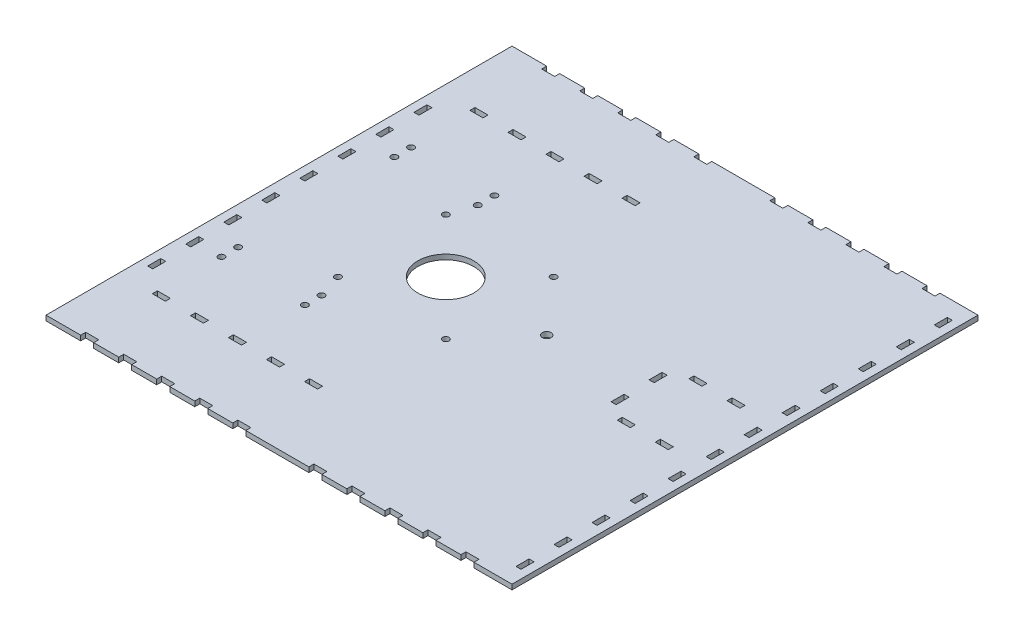
from build123d import *

# Parameters (mm, degrees)
SKETCH1_W                = 279.4
SKETCH1_H                = 279.4
BOSS_EXTRUDE1_DEPTH      = 3
SKETCH3_W                = 3
SKETCH3_H                = 7.8
CUT_EXTRUDE2_DEPTH       = 198.588410591
LPATTERN1_COUNT          = 12
LPATTERN1_PITCH          = 22.8
SKETCH5_W                = 7.8
SKETCH5_H                = 3
CUT_EXTRUDE3_DEPTH       = 198.588410591
LPATTERN2_COUNT          = 11
LPATTERN2_PITCH          = 22.8
MIRROR2_COPY_1_SKETCH_W  = 7.8
MIRROR2_COPY_1_SKETCH_H  = 3
MIRROR2_COPY_1_DEPTH     = 198.588410591
MIRROR2_COPY_2_SKETCH_W  = 7.8
MIRROR2_COPY_2_SKETCH_H  = 3
MIRROR2_COPY_2_DEPTH     = 198.588410591
MIRROR2_COPY_3_SKETCH_W  = 7.8
MIRROR2_COPY_3_SKETCH_H  = 3
MIRROR2_COPY_3_DEPTH     = 198.588410591
MIRROR2_COPY_4_SKETCH_W  = 7.8
MIRROR2_COPY_4_SKETCH_H  = 3
MIRROR2_COPY_4_DEPTH     = 198.588410591
MIRROR2_COPY_5_SKETCH_W  = 7.8
MIRROR2_COPY_5_SKETCH_H  = 3
MIRROR2_COPY_5_DEPTH     = 198.588410591
MIRROR2_COPY_6_SKETCH_W  = 7.8
MIRROR2_COPY_6_SKETCH_H  = 3
MIRROR2_COPY_6_DEPTH     = 198.588410591
MIRROR2_COPY_7_SKETCH_W  = 7.8
MIRROR2_COPY_7_SKETCH_H  = 3
MIRROR2_COPY_7_DEPTH     = 198.588410591
MIRROR2_COPY_8_SKETCH_W  = 7.8
MIRROR2_COPY_8_SKETCH_H  = 3
MIRROR2_COPY_8_DEPTH     = 198.588410591
MIRROR2_COPY_9_SKETCH_W  = 7.8
MIRROR2_COPY_9_SKETCH_H  = 3
MIRROR2_COPY_9_DEPTH     = 198.588410591
MIRROR2_COPY_10_SKETCH_W = 7.8
MIRROR2_COPY_10_SKETCH_H = 3
MIRROR2_COPY_10_DEPTH    = 198.588410591
SKETCH6_W                = 3
SKETCH6_H                = 7.8
CUT_EXTRUDE4_DEPTH       = 198.588410591
LPATTERN3_COUNT          = 8
LPATTERN3_PITCH          = 22.8
SKETCH7_R                = 16.75
CUT_EXTRUDE5_DEPTH       = 198.588410591
F_6_CLEARANCE_HOLE1_D    = 3.7973
F_6_CLEARANCE_HOLE2_D    = 3.7973
SKETCH14_R               = 2.65
CUT_EXTRUDE6_DEPTH       = 198.588410591
SKETCH16_W               = 7.8
SKETCH16_H               = 3
CUT_EXTRUDE8_DEPTH       = 198.588410591
LPATTERN5_COUNT          = 5
LPATTERN5_PITCH          = 22.8
MIRROR4_COPY_1_SKETCH_W  = 7.8
MIRROR4_COPY_1_SKETCH_H  = 3
MIRROR4_COPY_1_DEPTH     = 198.588410591
MIRROR4_COPY_2_SKETCH_W  = 7.8
MIRROR4_COPY_2_SKETCH_H  = 3
MIRROR4_COPY_2_DEPTH     = 198.588410591
MIRROR4_COPY_3_SKETCH_W  = 7.8
MIRROR4_COPY_3_SKETCH_H  = 3
MIRROR4_COPY_3_DEPTH     = 198.588410591
MIRROR4_COPY_4_SKETCH_W  = 7.8
MIRROR4_COPY_4_SKETCH_H  = 3
MIRROR4_COPY_4_DEPTH     = 198.588410591
MIRROR4_COPY_5_SKETCH_W  = 7.8
MIRROR4_COPY_5_SKETCH_H  = 3
MIRROR4_COPY_5_DEPTH     = 198.588410591
SKETCH17_W               = 7.8
SKETCH17_H               = 3
CUT_EXTRUDE9_DEPTH       = 198.588410591
LPATTERN6_COUNT          = 2
LPATTERN6_PITCH          = 22.8
SKETCH18_W               = 3
SKETCH18_H               = 7.8
CUT_EXTRUDE10_DEPTH      = 198.588410591
MIRROR5_COPY_1_SKETCH_W  = 7.8
MIRROR5_COPY_1_SKETCH_H  = 3
MIRROR5_COPY_1_DEPTH     = 198.588410591


with BuildPart() as part:
    # Sketch1 → Boss-Extrude1 (new body)
    with BuildSketch(Plane(origin=(0, 0, 0), x_dir=(1, 0, 0), z_dir=(0, 1, 0))):
        Rectangle(SKETCH1_W, SKETCH1_H)
    extrude(amount=BOSS_EXTRUDE1_DEPTH)

    # Sketch3 → Cut-Extrude2 (cut, through all)
    with BuildSketch(Plane(origin=(0, 0, 0), x_dir=(-1, 0, 0), z_dir=(0, -1, 0))):
        with Locations((-133.2, 125.4)):
            Rectangle(SKETCH3_W, SKETCH3_H)
    cut_extrude2 = extrude(amount=-CUT_EXTRUDE2_DEPTH, mode=Mode.SUBTRACT)

    # LPattern1: Cut-Extrude2 ×12
    with Locations(*[(0, 0, i * LPATTERN1_PITCH) for i in range(1, LPATTERN1_COUNT)]):
        add(cut_extrude2, mode=Mode.SUBTRACT)

    # Sketch5 → Cut-Extrude3 (cut, through all)
    with BuildSketch(Plane.XZ):
        with Locations((113, -138.2)):
            Rectangle(SKETCH5_W, SKETCH5_H)
    cut_extrude3 = extrude(amount=-CUT_EXTRUDE3_DEPTH, mode=Mode.SUBTRACT)

    # LPattern2: Cut-Extrude3 ×11, 1 skipped
    with Locations(*[(-i * LPATTERN2_PITCH, 0, 0) for i in range(1, LPATTERN2_COUNT) if i not in (5,)]):
        add(cut_extrude3, mode=Mode.SUBTRACT)

    # Mirror2 copy 1 sketch → Mirror2 copy 1 (cut, through all)
    with BuildSketch(Plane(origin=(-22.8, 0, 0), x_dir=(1, 0, 0), z_dir=(0, -1, 0))):
        with Locations((113, 138.2)):
            Rectangle(MIRROR2_COPY_1_SKETCH_W, MIRROR2_COPY_1_SKETCH_H)
    extrude(amount=-MIRROR2_COPY_1_DEPTH, mode=Mode.SUBTRACT)

    # Mirror2 copy 2 sketch → Mirror2 copy 2 (cut, through all)
    with BuildSketch(Plane(origin=(-45.6, 0, 0), x_dir=(1, 0, 0), z_dir=(0, -1, 0))):
        with Locations((113, 138.2)):
            Rectangle(MIRROR2_COPY_2_SKETCH_W, MIRROR2_COPY_2_SKETCH_H)
    extrude(amount=-MIRROR2_COPY_2_DEPTH, mode=Mode.SUBTRACT)

    # Mirror2 copy 3 sketch → Mirror2 copy 3 (cut, through all)
    with BuildSketch(Plane(origin=(-68.4, 0, 0), x_dir=(1, 0, 0), z_dir=(0, -1, 0))):
        with Locations((113, 138.2)):
            Rectangle(MIRROR2_COPY_3_SKETCH_W, MIRROR2_COPY_3_SKETCH_H)
    extrude(amount=-MIRROR2_COPY_3_DEPTH, mode=Mode.SUBTRACT)

    # Mirror2 copy 4 sketch → Mirror2 copy 4 (cut, through all)
    with BuildSketch(Plane(origin=(-91.2, 0, 0), x_dir=(1, 0, 0), z_dir=(0, -1, 0))):
        with Locations((113, 138.2)):
            Rectangle(MIRROR2_COPY_4_SKETCH_W, MIRROR2_COPY_4_SKETCH_H)
    extrude(amount=-MIRROR2_COPY_4_DEPTH, mode=Mode.SUBTRACT)

    # Mirror2 copy 5 sketch → Mirror2 copy 5 (cut, through all)
    with BuildSketch(Plane(origin=(-136.8, 0, 0), x_dir=(1, 0, 0), z_dir=(0, -1, 0))):
        with Locations((113, 138.2)):
            Rectangle(MIRROR2_COPY_5_SKETCH_W, MIRROR2_COPY_5_SKETCH_H)
    extrude(amount=-MIRROR2_COPY_5_DEPTH, mode=Mode.SUBTRACT)

    # Mirror2 copy 6 sketch → Mirror2 copy 6 (cut, through all)
    with BuildSketch(Plane(origin=(-159.6, 0, 0), x_dir=(1, 0, 0), z_dir=(0, -1, 0))):
        with Locations((113, 138.2)):
            Rectangle(MIRROR2_COPY_6_SKETCH_W, MIRROR2_COPY_6_SKETCH_H)
    extrude(amount=-MIRROR2_COPY_6_DEPTH, mode=Mode.SUBTRACT)

    # Mirror2 copy 7 sketch → Mirror2 copy 7 (cut, through all)
    with BuildSketch(Plane(origin=(-182.4, 0, 0), x_dir=(1, 0, 0), z_dir=(0, -1, 0))):
        with Locations((113, 138.2)):
            Rectangle(MIRROR2_COPY_7_SKETCH_W, MIRROR2_COPY_7_SKETCH_H)
    extrude(amount=-MIRROR2_COPY_7_DEPTH, mode=Mode.SUBTRACT)

    # Mirror2 copy 8 sketch → Mirror2 copy 8 (cut, through all)
    with BuildSketch(Plane(origin=(-205.2, 0, 0), x_dir=(1, 0, 0), z_dir=(0, -1, 0))):
        with Locations((113, 138.2)):
            Rectangle(MIRROR2_COPY_8_SKETCH_W, MIRROR2_COPY_8_SKETCH_H)
    extrude(amount=-MIRROR2_COPY_8_DEPTH, mode=Mode.SUBTRACT)

    # Mirror2 copy 9 sketch → Mirror2 copy 9 (cut, through all)
    with BuildSketch(Plane(origin=(-228, 0, 0), x_dir=(1, 0, 0), z_dir=(0, -1, 0))):
        with Locations((113, 138.2)):
            Rectangle(MIRROR2_COPY_9_SKETCH_W, MIRROR2_COPY_9_SKETCH_H)
    extrude(amount=-MIRROR2_COPY_9_DEPTH, mode=Mode.SUBTRACT)

    # Mirror2 copy 10 sketch → Mirror2 copy 10 (cut, through all)
    with BuildSketch(Plane.XZ):
        with Locations((113, 138.2)):
            Rectangle(MIRROR2_COPY_10_SKETCH_W, MIRROR2_COPY_10_SKETCH_H)
    extrude(amount=-MIRROR2_COPY_10_DEPTH, mode=Mode.SUBTRACT)

    # Sketch6 → Cut-Extrude4 (cut, through all)
    with BuildSketch(Plane.XZ):
        with Locations((-133.2, -79.8)):
            Rectangle(SKETCH6_W, SKETCH6_H)
    cut_extrude4 = extrude(amount=-CUT_EXTRUDE4_DEPTH, mode=Mode.SUBTRACT)

    # LPattern3: Cut-Extrude4 ×8
    with Locations(*[(0, 0, i * LPATTERN3_PITCH) for i in range(1, LPATTERN3_COUNT)]):
        add(cut_extrude4, mode=Mode.SUBTRACT)

    # Sketch7 → Cut-Extrude5 (cut, through all)
    with BuildSketch(Plane(origin=(0, 0, 0), x_dir=(-1, 0, 0), z_dir=(0, -1, 0))):
        with Locations((39.7, 0)):
            Circle(SKETCH7_R)
    extrude(amount=-CUT_EXTRUDE5_DEPTH, mode=Mode.SUBTRACT)

    # #6 Clearance Hole1 (through all)
    with Locations(Plane(origin=(0, 3, 0), x_dir=(1, 0, 0), z_dir=(0, 1, 0))):
        with Locations((-72.025, -32.325), (-72.025, 32.325), (-7.375, 32.325), (-7.375, -32.325)):
            Hole(F_6_CLEARANCE_HOLE1_D / 2)

    # #6 Clearance Hole2 (through all)
    with Locations(Plane(origin=(0, 3, 0), x_dir=(1, 0, 0), z_dir=(0, 1, 0))):
        with Locations((-117.36, 56.83), (-67.36, 56.83), (-117.36, -56.83), (-67.36, -56.83), (-67.36, -46.83), (-117.36, -46.83), (-67.36, 46.83), (-117.36, 46.83)):
            Hole(F_6_CLEARANCE_HOLE2_D / 2)

    # Sketch14 → Cut-Extrude6 (cut, through all)
    with BuildSketch(Plane(origin=(0, 0, 0), x_dir=(-1, 0, 0), z_dir=(0, -1, 0))):
        with Locations((-20.8, 0)):
            Circle(SKETCH14_R)
    extrude(amount=-CUT_EXTRUDE6_DEPTH, mode=Mode.SUBTRACT)

    # Sketch16 → Cut-Extrude8 (cut, through all)
    with BuildSketch(Plane.XZ):
        with Locations((-115, 95.2)):
            Rectangle(SKETCH16_W, SKETCH16_H)
    cut_extrude8 = extrude(amount=-CUT_EXTRUDE8_DEPTH, mode=Mode.SUBTRACT)

    # LPattern5: Cut-Extrude8 ×5
    with Locations(*[(i * LPATTERN5_PITCH, 0, 0) for i in range(1, LPATTERN5_COUNT)]):
        add(cut_extrude8, mode=Mode.SUBTRACT)

    # Mirror4 copy 1 sketch → Mirror4 copy 1 (cut, through all)
    with BuildSketch(Plane(origin=(22.8, 0, 0), x_dir=(1, 0, 0), z_dir=(0, -1, 0))):
        with Locations((-115, -95.2)):
            Rectangle(MIRROR4_COPY_1_SKETCH_W, MIRROR4_COPY_1_SKETCH_H)
    extrude(amount=-MIRROR4_COPY_1_DEPTH, mode=Mode.SUBTRACT)

    # Mirror4 copy 2 sketch → Mirror4 copy 2 (cut, through all)
    with BuildSketch(Plane(origin=(45.6, 0, 0), x_dir=(1, 0, 0), z_dir=(0, -1, 0))):
        with Locations((-115, -95.2)):
            Rectangle(MIRROR4_COPY_2_SKETCH_W, MIRROR4_COPY_2_SKETCH_H)
    extrude(amount=-MIRROR4_COPY_2_DEPTH, mode=Mode.SUBTRACT)

    # Mirror4 copy 3 sketch → Mirror4 copy 3 (cut, through all)
    with BuildSketch(Plane(origin=(68.4, 0, 0), x_dir=(1, 0, 0), z_dir=(0, -1, 0))):
        with Locations((-115, -95.2)):
            Rectangle(MIRROR4_COPY_3_SKETCH_W, MIRROR4_COPY_3_SKETCH_H)
    extrude(amount=-MIRROR4_COPY_3_DEPTH, mode=Mode.SUBTRACT)

    # Mirror4 copy 4 sketch → Mirror4 copy 4 (cut, through all)
    with BuildSketch(Plane(origin=(91.2, 0, 0), x_dir=(1, 0, 0), z_dir=(0, -1, 0))):
        with Locations((-115, -95.2)):
            Rectangle(MIRROR4_COPY_4_SKETCH_W, MIRROR4_COPY_4_SKETCH_H)
    extrude(amount=-MIRROR4_COPY_4_DEPTH, mode=Mode.SUBTRACT)

    # Mirror4 copy 5 sketch → Mirror4 copy 5 (cut, through all)
    with BuildSketch(Plane.XZ):
        with Locations((-115, -95.2)):
            Rectangle(MIRROR4_COPY_5_SKETCH_W, MIRROR4_COPY_5_SKETCH_H)
    extrude(amount=-MIRROR4_COPY_5_DEPTH, mode=Mode.SUBTRACT)

    # Sketch17 → Cut-Extrude9 (cut, through all)
    with BuildSketch(Plane.XZ):
        with Locations((112.8, 21.5)):
            Rectangle(SKETCH17_W, SKETCH17_H)
    cut_extrude9 = extrude(amount=-CUT_EXTRUDE9_DEPTH, mode=Mode.SUBTRACT)

    # LPattern6: Cut-Extrude9 ×2
    with Locations(*[(-i * LPATTERN6_PITCH, 0, 0) for i in range(1, LPATTERN6_COUNT)]):
        add(cut_extrude9, mode=Mode.SUBTRACT)

    # Sketch18 → Cut-Extrude10 (cut, through all)
    with BuildSketch(Plane(origin=(0, 0, 0), x_dir=(-1, 0, 0), z_dir=(0, -1, 0))):
        with Locations((-76.2, -11.4)):
            Rectangle(SKETCH18_W, SKETCH18_H)
    cut_extrude10 = extrude(amount=-CUT_EXTRUDE10_DEPTH, mode=Mode.SUBTRACT)

    # Mirror5: Cut-Extrude9, Cut-Extrude10 across plane
    add(cut_extrude9.mirror(Plane.XY), mode=Mode.SUBTRACT)
    add(cut_extrude10.mirror(Plane.XY), mode=Mode.SUBTRACT)

    # Mirror5 copy 1 sketch → Mirror5 copy 1 (cut, through all)
    with BuildSketch(Plane(origin=(-22.8, 0, 0), x_dir=(1, 0, 0), z_dir=(0, -1, 0))):
        with Locations((112.8, -21.5)):
            Rectangle(MIRROR5_COPY_1_SKETCH_W, MIRROR5_COPY_1_SKETCH_H)
    extrude(amount=-MIRROR5_COPY_1_DEPTH, mode=Mode.SUBTRACT)


solid = part.part
